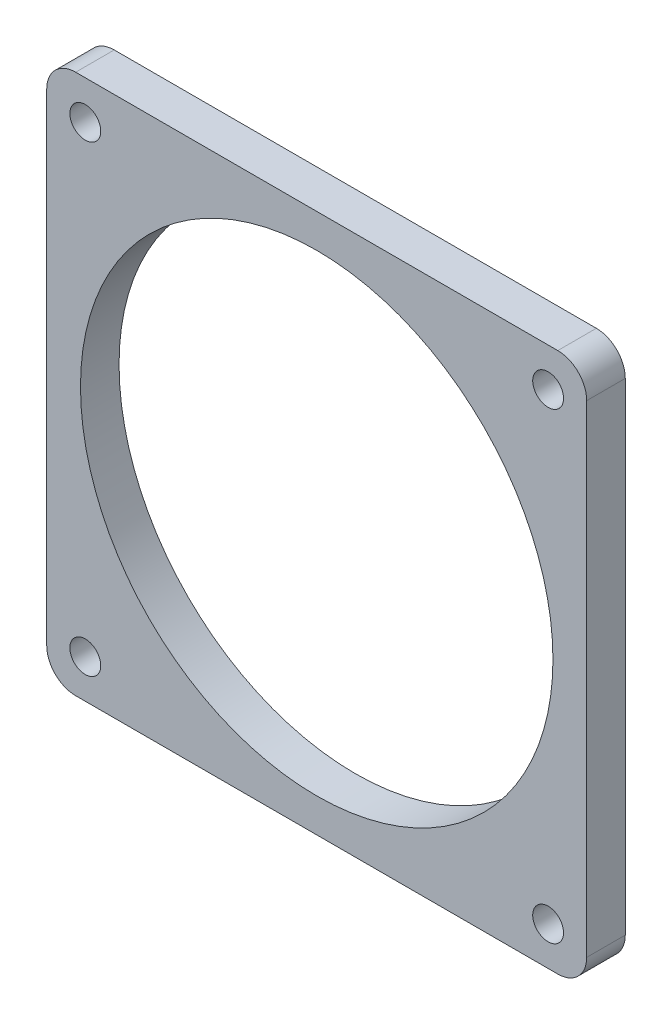
from build123d import *

# Parameters (mm, degrees)
SKETCH_1_W             = 56
SKETCH_1_H             = 56
SM_BASE_FLANGE_1_DEPTH = 4
SKETCH_6_R             = 24.5
SKETCH_6_R_2           = 1.6
CUT_EXTRUDE_1_DEPTH    = 4
FILLET_1_R             = 3


# Sheet-metal steps are written as plain solids
with BuildPart() as part:
    # Sketch 1 → Базовая кромка1 (new body)
    with BuildSketch(Plane.XY):
        Rectangle(SKETCH_1_W, SKETCH_1_H)
    extrude(amount=-SM_BASE_FLANGE_1_DEPTH)

    # Эскиз6 → Вырез-Вытянуть1 (cut)
    with BuildSketch(Plane.XY):
        Circle(SKETCH_6_R)
        with Locations((-24, 24)):
            Circle(SKETCH_6_R_2)
        with Locations((24, 24)):
            Circle(SKETCH_6_R_2)
        with Locations((24, -24)):
            Circle(SKETCH_6_R_2)
        with Locations((-24, -24)):
            Circle(SKETCH_6_R_2)
    extrude(amount=-CUT_EXTRUDE_1_DEPTH, mode=Mode.SUBTRACT)

    # Скругление1
    fillet_1_edges = [part.edges().sort_by_distance(p)[0] for p in [
        (28, -28, -2),
        (-28, -28, -2),
        (-28, 28, -2),
        (28, 28, -2),
    ]]
    fillet(fillet_1_edges, radius=FILLET_1_R)


solid = part.part
